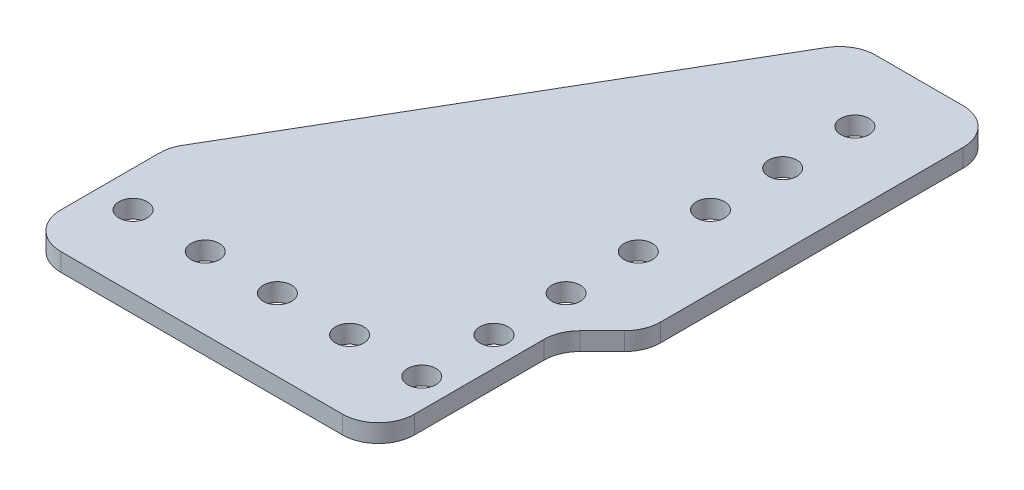
from build123d import *

# Parameters (mm, degrees)
SKETCH2_R           = 2.4892
BOSS_EXTRUDE1_DEPTH = 3.175
LPATTERN1_OUTLINE_R = 2.4892
LPATTERN1_DEPTH     = 3.175
CUT_EXTRUDE1_DEPTH  = 124.335571207
FILLET2_R           = 6.35


# Read off the part's stored shape, not the designer's step: LPattern1
with BuildPart() as part:
    # Sketch2 → Boss-Extrude1 (new body)
    with BuildSketch(Plane(origin=(0, 0, 0), x_dir=(1, 0, 0), z_dir=(0, 1, 0))):
        Polygon((0, 0), (0, 101.6), (-25.4, 101.6), (-69.85, 25.4), (-69.85, 0), align=None)
        with Locations(Location((-12.7, 12.7, 0), (0, 0, 270))):
            Circle(SKETCH2_R, mode=Mode.SUBTRACT)
    extrude(amount=BOSS_EXTRUDE1_DEPTH)

    # LPattern1 outline → LPattern1 (cut)
    with BuildSketch(Plane(origin=(0, 0, 0), x_dir=(1, 0, 0), z_dir=(0, 1, 0))):
        with Locations((-63.5, 12.7)):
            Circle(LPATTERN1_OUTLINE_R)
        with Locations((-50.8, 12.7)):
            Circle(LPATTERN1_OUTLINE_R)
        with Locations((-38.1, 12.7)):
            Circle(LPATTERN1_OUTLINE_R)
        with Locations((-25.4, 12.7)):
            Circle(LPATTERN1_OUTLINE_R)
        with Locations((-12.7, 88.9)):
            Circle(LPATTERN1_OUTLINE_R)
        with Locations((-12.7, 76.2)):
            Circle(LPATTERN1_OUTLINE_R)
        with Locations((-12.7, 63.5)):
            Circle(LPATTERN1_OUTLINE_R)
        with Locations((-12.7, 50.8)):
            Circle(LPATTERN1_OUTLINE_R)
        with Locations((-12.7, 38.1)):
            Circle(LPATTERN1_OUTLINE_R)
        with Locations((-12.7, 25.4)):
            Circle(LPATTERN1_OUTLINE_R)
    extrude(amount=LPATTERN1_DEPTH, mode=Mode.SUBTRACT)

    # Sketch3 → Cut-Extrude1 (cut, through all)
    with BuildSketch(Plane(origin=(0, 3.175, 0), x_dir=(1, 0, 0), z_dir=(0, 1, 0))):
        Polygon((-7.62, 31.75), (0, 39.37), (0, 31.75), (0, 0), (-7.62, 0), align=None)
    extrude(amount=-CUT_EXTRUDE1_DEPTH, mode=Mode.SUBTRACT)

    # Fillet2
    fillet2_edges = [part.edges().sort_by_distance(p)[0] for p in [
        (-7.62, 1.5875, 0),
        (-7.62, 1.5875, -31.75),
        (0, 1.5875, -39.37),
        (-69.85, 1.5875, 0),
        (-69.85, 1.5875, -25.4),
        (-25.4, 1.5875, -101.6),
        (0, 1.5875, -101.6),
    ]]
    fillet(fillet2_edges, radius=FILLET2_R)


solid = part.part
